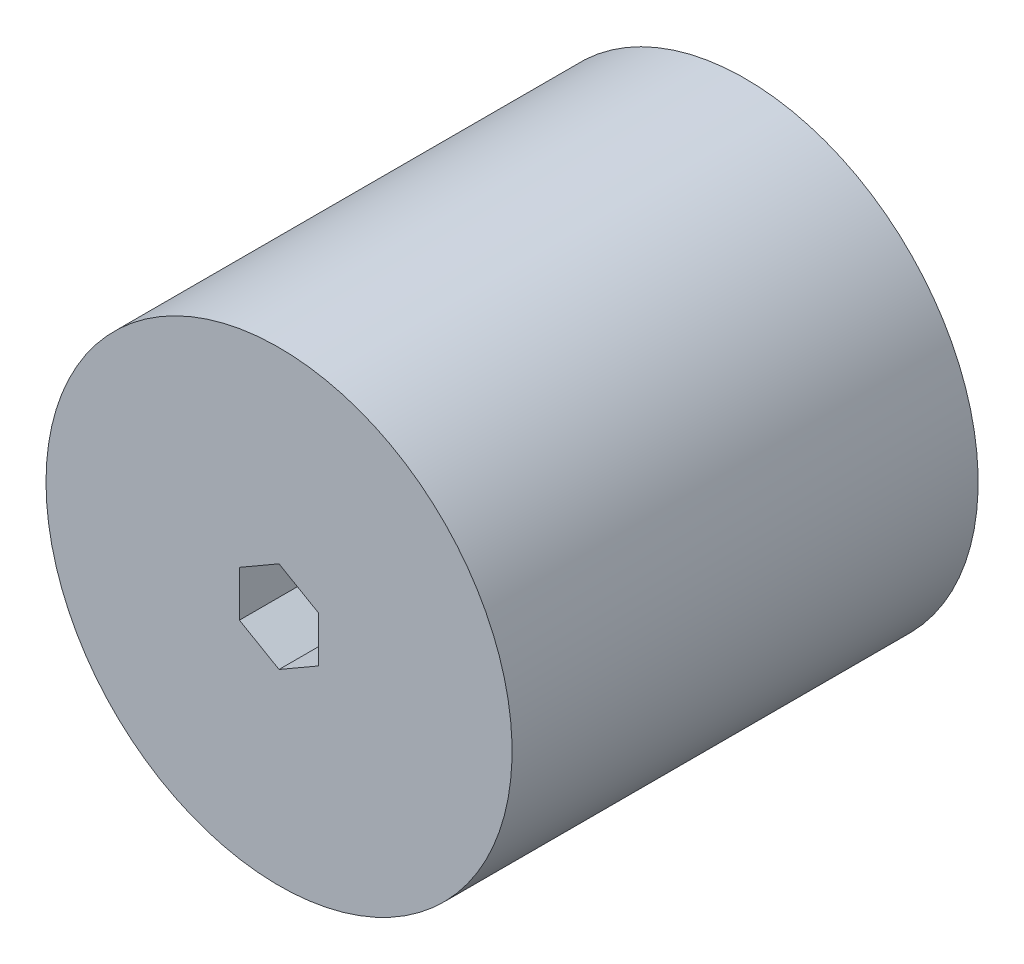
from build123d import *

# Parameters (mm, degrees)
SKETCH1_R           = 38.1
BOSS_EXTRUDE1_DEPTH = 76.2


with BuildPart() as part:
    # Sketch1 → Boss-Extrude1 (new body)
    with BuildSketch(Plane.XY):
        Circle(SKETCH1_R)
        Polygon((0, 7.478995387), (-6.477, 3.739497694), (-6.477, -3.739497694), (0, -7.478995387), (6.477, -3.739497694), (6.477, 3.739497694), align=None, mode=Mode.SUBTRACT)
    extrude(amount=BOSS_EXTRUDE1_DEPTH)


solid = part.part
